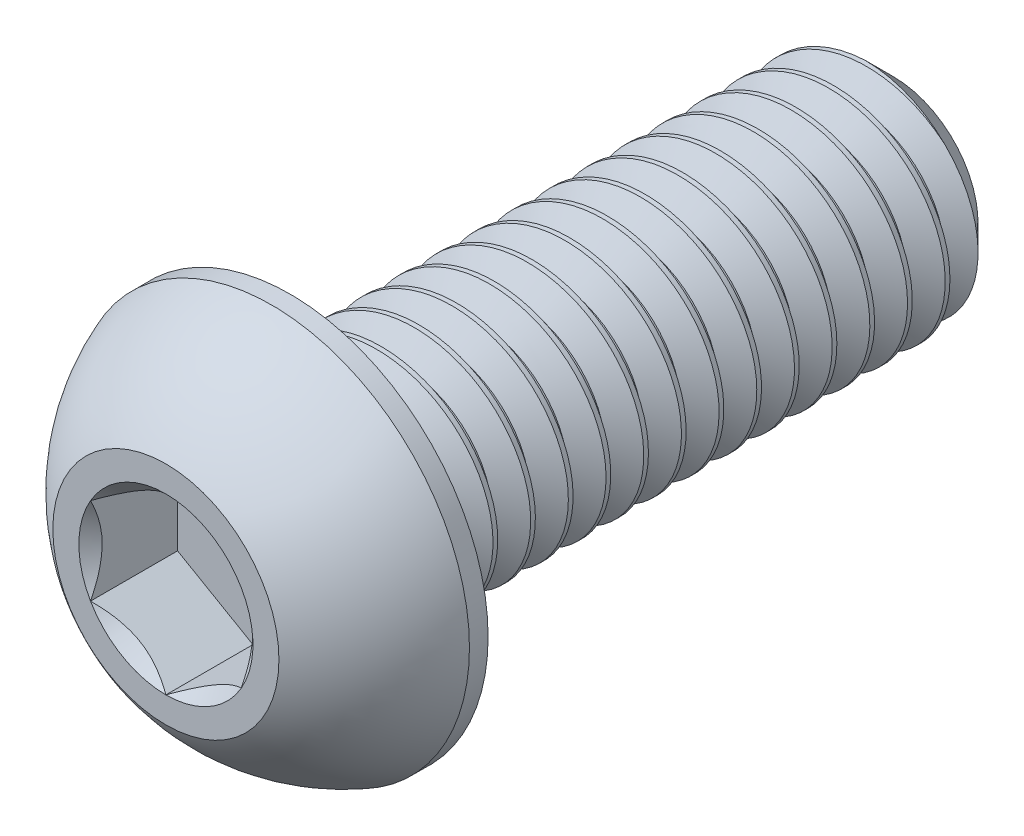
from build123d import *

# Parameters (mm, degrees)
SKETCH1_W          = 16
SKETCH1_H          = 3
CHAMFER1_SIZE      = 0.75
CUT_EXTRUDE2_DEPTH = 2.31
CUT_SWEEP1_PITCH   = 1


with BuildPart() as part:
    # Sketch1 → Revolve1 (revolve)
    with BuildSketch(Plane(origin=(0, 0, 0), x_dir=(0, 0, -1), z_dir=(1, 0, 0))):
        with Locations((11.3, 1.5)):
            Rectangle(SKETCH1_W, SKETCH1_H)
    revolve(axis=Axis((0, 0, -19.3), (0, 0, 1)))

    # Chamfer1
    chamfer1_edges = [part.edges().sort_by_distance(p)[0] for p in [
        (0, -3, -19.3),
    ]]
    chamfer(chamfer1_edges, length=CHAMFER1_SIZE)

    # Sketch7 → Revolve2 (revolve)
    with BuildSketch(Plane(origin=(0, 0, 0), x_dir=(0, 0, -1), z_dir=(1, 0, 0)), mode=Mode.PRIVATE) as revolve2_sk:
        with BuildLine():
            Line((2.805, 5.25), (3.3, 5.25))
            Line((3.3, 5.25), (3.3, 0))
            Line((3.3, 0), (0, 0))
            Line((0, 0), (0, 3))
            ThreePointArc((0, 3), (1.216479019, 4.356906156), (2.805, 5.25))
        make_face()
    revolve(revolve2_sk.sketch.rotate(Axis((0, 0, 0), (0, 0, -1)), 180), axis=Axis((0, 0, 0), (0, 0, -1)))

    # Sketch5 → Cut-Extrude2 (cut)
    with BuildSketch(Plane.XY):
        Polygon((2, -1.154700538), (2, 1.154700538), (0, 2.309401077), (-2, 1.154700538), (-2, -1.154700538), (0, -2.309401077), align=None)
    extrude(amount=-CUT_EXTRUDE2_DEPTH, mode=Mode.SUBTRACT)

    # Cut-Extrude3 cone 1 section (through the dimple's axis) → Cut-Extrude3 (revolve, cut)
    with BuildSketch(Plane(origin=(0, 0, 0), x_dir=(0, -1, 0), z_dir=(1, 0, 0))):
        Polygon((0, 0), (2.309401077, 0), (0, 2.309401077), align=None)
    revolve(axis=Axis((0, 0, 0), (0, 0, -1)), mode=Mode.SUBTRACT)

    # Cut-Sweep1: the profile of Sketch2 profile screwed along a right-hand helix of 17 turns, 8 arcs to a turn; built about Z, then put on its axis
    cut_sweep1_z = Axis((0, 0, 0), (0, 0, 1))
    cut_sweep1_corners = [(3.0003, 0, 0.750173205), (3.0003, 0, -0.125173205), (2.350480947, 0, 0.25), (2.350480947, 0, 0.375)]
    with BuildLine(mode=Mode.PRIVATE) as cut_sweep1_profile:
        Line(cut_sweep1_corners[0], cut_sweep1_corners[1])
        Line(cut_sweep1_corners[1], cut_sweep1_corners[2])
        Line(cut_sweep1_corners[2], cut_sweep1_corners[3])
        Line(cut_sweep1_corners[3], cut_sweep1_corners[0])
    cut_sweep1_cap = Face(cut_sweep1_profile.wire())
    cut_sweep1_turn_angles = [0, 22.5, 45, 67.5, 90, 112.5, 135, 157.5, 180, 202.5, 225, 247.5, 270, 292.5, 315, 337.5, 360]
    cut_sweep1_turn_weights = [1, 0.9238795325112867, 1, 0.9238795325112867, 1, 0.9238795325112867, 1, 0.9238795325112867, 1, 0.9238795325112867, 1, 0.9238795325112867, 1, 0.9238795325112867, 1, 0.9238795325112867, 1]
    cut_sweep1_turn_rails = [Edge.make_bspline([Vector(p[0], p[1], 0).rotate(cut_sweep1_z, cut_sweep1_turn_angles[k]) / cut_sweep1_turn_weights[k] + Vector(0, 0, p[2] + CUT_SWEEP1_PITCH * cut_sweep1_turn_angles[k] / 360) for k in range(17)], [0, 0, 0, 1, 1, 2, 2, 3, 3, 4, 4, 5, 5, 6, 6, 7, 7, 8, 8, 8], 2, cut_sweep1_turn_weights) for p in cut_sweep1_corners]
    cut_sweep1_turn_sides = [Face.make_surface_from_curves(cut_sweep1_turn_rails[p[0]], cut_sweep1_turn_rails[p[1]]) for p in [(0, 1), (1, 2), (2, 3), (3, 0)]]
    cut_sweep1 = Plane(origin=(0, 0, -19.3), x_dir=(0, 1, 0), z_dir=(0, 0, 1)) * Solid(Shell([*[p.moved(Location((0, 0, CUT_SWEEP1_PITCH * i))) for i in range(17) for p in cut_sweep1_turn_sides], cut_sweep1_cap, cut_sweep1_cap.rotate(cut_sweep1_z, 6120).moved(Location((0, 0, CUT_SWEEP1_PITCH * 6120 / 360)))]))
    add(cut_sweep1, mode=Mode.SUBTRACT)


solid = part.part
